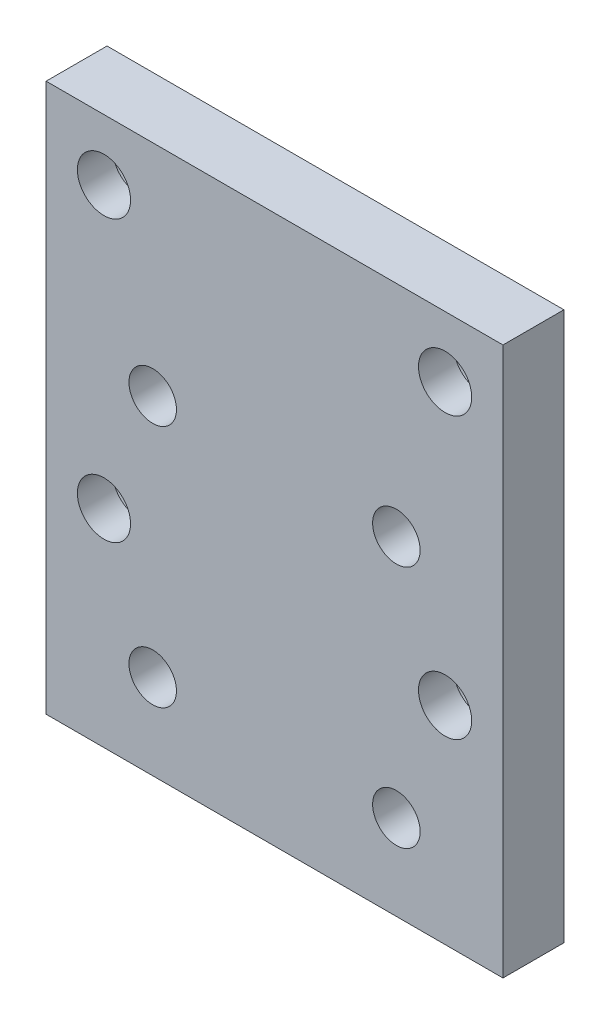
from build123d import *

# Parameters (mm, degrees)
SKETCH6_W                                      = 10
SKETCH6_H                                      = 90
BOSS_EXTRUDE3_DEPTH                            = 75
CBORE_FOR_5_16_BUTTON_HEAD_CAP_SCREW1_AT_COUNT = 2
CBORE_FOR_5_16_BUTTON_HEAD_CAP_SCREW1_AT_PITCH = 46
CBORE_FOR_5_16_BUTTON_HEAD_CAP_SCREW_2_COUNT   = 2
CBORE_FOR_5_16_BUTTON_HEAD_CAP_SCREW_2_PITCH   = 56
CBORE_FOR_5_16_BUTTON_HEAD_CAP_SCREW_3_COUNT   = 2
CBORE_FOR_5_16_BUTTON_HEAD_CAP_SCREW_3_PITCH   = 72.470683728
SKETCH13_R                                     = 3.9
CUT_EXTRUDE7_DEPTH                             = 10


with BuildPart() as part:
    # Sketch6 → Boss-Extrude3 (new body)
    with BuildSketch(Plane(origin=(0, 0, 0), x_dir=(0, 0, -1), z_dir=(1, 0, 0))):
        Rectangle(SKETCH6_W, SKETCH6_H)
    extrude(amount=BOSS_EXTRUDE3_DEPTH)

    # Sketch12 → CBORE for 5/16 Button Head Cap Screw1 (revolve, cut)
    with BuildSketch(Plane(origin=(65.5, 35, -5), x_dir=(0, 1, 0), z_dir=(1, 0, 0))):
        Polygon((0, 0), (0, 10), (4.36499, 10), (4.36499, 4.2164), (7.34187, 4.2164), (7.34187, 0.635), (7.97687, 0), align=None)
    cbore_for_5_16_button_head_cap_screw1 = revolve(axis=Axis((65.5, 35, -11.35), (0, 0, 1)), mode=Mode.SUBTRACT)

    # CBORE for 5/16 Button Head Cap Screw1 at: CBORE for 5/16 Button Head Cap Screw1 ×2
    with Locations(*[(0, -i * CBORE_FOR_5_16_BUTTON_HEAD_CAP_SCREW1_AT_PITCH, 0) for i in range(1, CBORE_FOR_5_16_BUTTON_HEAD_CAP_SCREW1_AT_COUNT)]):
        add(cbore_for_5_16_button_head_cap_screw1, mode=Mode.SUBTRACT)

    # CBORE for 5_16 Button Head Cap Screw 2: CBORE for 5/16 Button Head Cap Screw1 ×2
    with Locations(*[(-i * CBORE_FOR_5_16_BUTTON_HEAD_CAP_SCREW_2_PITCH, 0, 0) for i in range(1, CBORE_FOR_5_16_BUTTON_HEAD_CAP_SCREW_2_COUNT)]):
        add(cbore_for_5_16_button_head_cap_screw1, mode=Mode.SUBTRACT)

    # CBORE for 5_16 Button Head Cap Screw 3: CBORE for 5/16 Button Head Cap Screw1 ×2
    with Locations(*[Vector(-0.7727262545252344, -0.6347394233600139, 0) * (i * CBORE_FOR_5_16_BUTTON_HEAD_CAP_SCREW_3_PITCH) for i in range(1, CBORE_FOR_5_16_BUTTON_HEAD_CAP_SCREW_3_COUNT)]):
        add(cbore_for_5_16_button_head_cap_screw1, mode=Mode.SUBTRACT)

    # Sketch13 → Cut-Extrude7 (cut)
    with BuildSketch(Plane(origin=(0, 0, -5), x_dir=(-1, 0, 0), z_dir=(0, 0, -1))):
        with Locations((-57.5, -31)):
            Circle(SKETCH13_R)
        with Locations((-57.5, 9)):
            Circle(SKETCH13_R)
        with Locations((-17.5, 9)):
            Circle(SKETCH13_R)
        with Locations((-17.5, -31)):
            Circle(SKETCH13_R)
    extrude(amount=-CUT_EXTRUDE7_DEPTH, mode=Mode.SUBTRACT)


solid = part.part
